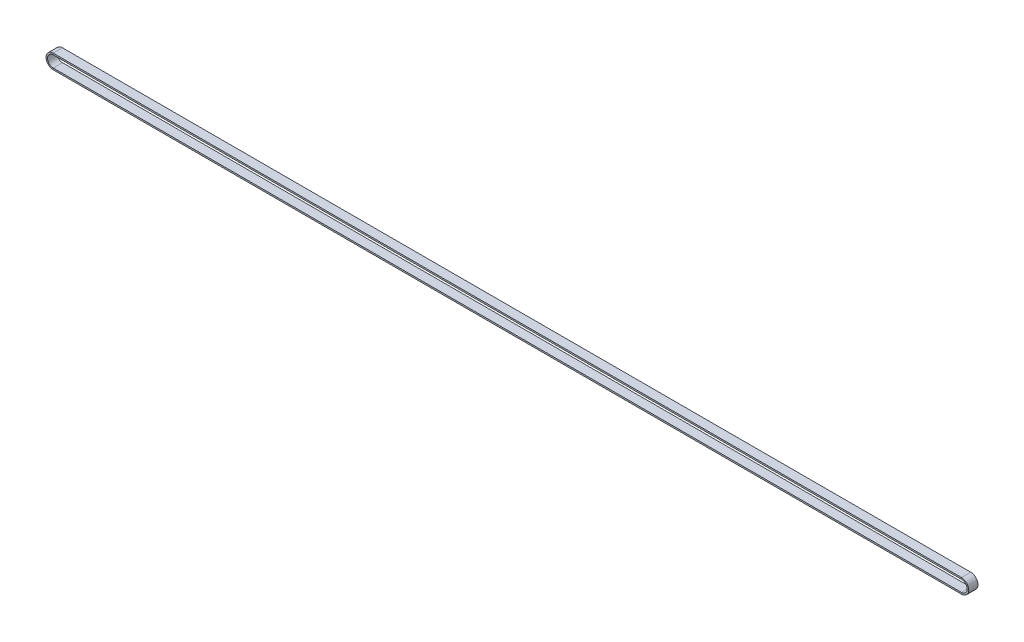
from build123d import *

# Parameters (mm, degrees)
SKETCH3_W = 9
SKETCH3_H = 1.5


with BuildPart() as part:
    # Sweep1: sweep along a path in Sketch2
    with BuildLine(Plane.XY) as sweep1_path:
        Line((4e-09, 2.138227034), (882.520262028, 2.138227034))
        ThreePointArc((882.520262028, 2.138227034), (889.520262028, -4.861772966), (882.520262029, -11.861772966))
        Line((882.520262029, -11.861772966), (5e-09, -11.861772966))
        ThreePointArc((5e-09, -11.861772966), (-6.999999996, -4.861772966), (4e-09, 2.138227034))
    # Sketch3 → Sweep1 (sweep)
    with BuildSketch(Plane(origin=(0, 0, 0), x_dir=(0, 0, -1), z_dir=(1, 0, 0))):
        with Locations((-4.5, 1.388227034)):
            Rectangle(SKETCH3_W, SKETCH3_H)
    sweep(path=sweep1_path.line)


solid = part.part
